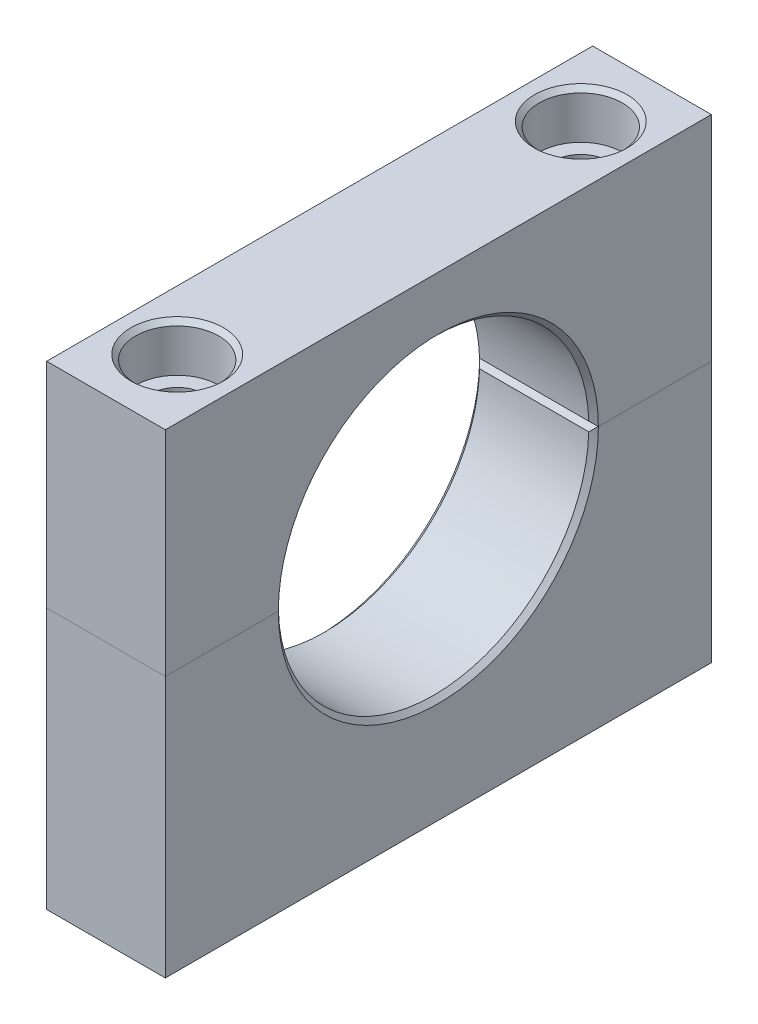
from build123d import *

# Parameters (mm, degrees)
BOSS_EXTRUDE1_DEPTH                           = 15.875
BOSS_EXTRUDE2_DEPTH                           = 15.875
CBORE_FOR_1_4_SOCKET_HEAD_CAP_SCREW1_AT_COUNT = 2
CBORE_FOR_1_4_SOCKET_HEAD_CAP_SCREW1_AT_PITCH = 53.975
MOVE_FACE1_BY                                 = 0.127
MOVE_FACE1_2_BY                               = 0.127
MOVE_START                                    = 28.575
MOVE_FACE2_OUTLINE_W                          = 15.875
MOVE_FACE2_OUTLINE_H                          = 73.025
MOVE_FACE2_OUTLINE_R                          = 5.55625
MOVE_FACE2_DEPTH                              = 6.35
MOVE_START_2                                  = 22.225
MOVE_FACE2_2_OUTLINE_R                        = 5.55625
MOVE_FACE2_2_OUTLINE_R_2                      = 3.57124
MOVE_FACE2_2_DEPTH                            = 6.35


with BuildPart() as part:
    # Sketch1 → Boss-Extrude1 (new body)
    with BuildSketch(Plane(origin=(0, 0, 0), x_dir=(0, 0, -1), z_dir=(1, 0, 0))):
        with BuildLine():
            Line((36.5125, 0), (20.6375, 0))
            ThreePointArc((20.6375, 0), (0, -20.6375), (-20.6375, 0))
            Line((-20.6375, 0), (-36.5125, 0))
            Line((-36.5125, 0), (-36.5125, -34.925))
            Line((-36.5125, -34.925), (36.5125, -34.925))
            Line((36.5125, -34.925), (36.5125, 0))
        make_face()
    extrude(amount=BOSS_EXTRUDE1_DEPTH)


with BuildPart() as body_2:
    # Sketch1<3> → Boss-Extrude2 (new body)
    with BuildSketch(Plane(origin=(0, 0, 0), x_dir=(0, 0, -1), z_dir=(1, 0, 0))):
        with BuildLine():
            ThreePointArc((-20.6375, 0), (0, 20.6375), (20.6375, 0))
            Line((20.6375, 0), (36.5125, 0))
            Line((36.5125, 0), (36.5125, 34.925))
            Line((36.5125, 34.925), (-36.5125, 34.925))
            Line((-36.5125, 34.925), (-36.5125, 0))
            Line((-36.5125, 0), (-20.6375, 0))
        make_face()
    extrude(amount=BOSS_EXTRUDE2_DEPTH)


with BuildPart() as cbore_for_1_4_socket_head_cap_screw1_tool:
    # Sketch4 → CBORE for 1/4 Socket Head Cap Screw1 (revolve)
    with BuildSketch(Plane(origin=(7.9375, 34.925, 26.9875), x_dir=(0, 0, 1), z_dir=(1, 0, 0))):
        Polygon((0, 0), (0, 69.85), (3.57124, 69.85), (3.57124, 6.35), (5.55625, 6.35), (5.55625, 0.635), (6.19125, 0), align=None)
    cbore_for_1_4_socket_head_cap_screw1 = revolve(axis=Axis((7.9375, 41.275, 26.9875), (0, -1, 0)))


with BuildPart() as part_1:
    add(part.part)

    # CBORE for 1/4 Socket Head Cap Screw1: cut by cbore_for_1_4_socket_head_cap_screw1_tool
    add(cbore_for_1_4_socket_head_cap_screw1_tool.part, mode=Mode.SUBTRACT)


with BuildPart() as body_2_1:
    add(body_2.part)

    # CBORE for 1/4 Socket Head Cap Screw1: cut by cbore_for_1_4_socket_head_cap_screw1_tool
    add(cbore_for_1_4_socket_head_cap_screw1_tool.part, mode=Mode.SUBTRACT)


with BuildPart() as cbore_for_1_4_socket_head_cap_screw1_at_tool:
    # CBORE for 1/4 Socket Head Cap Screw1 at: CBORE for 1/4 Socket Head Cap Screw1 ×2
    with Locations(*[(0, 0, -i * CBORE_FOR_1_4_SOCKET_HEAD_CAP_SCREW1_AT_PITCH) for i in range(1, CBORE_FOR_1_4_SOCKET_HEAD_CAP_SCREW1_AT_COUNT)]):
        add(cbore_for_1_4_socket_head_cap_screw1)


with BuildPart() as part_2:
    add(part_1.part)

    # CBORE for 1/4 Socket Head Cap Screw1 at: cut by cbore_for_1_4_socket_head_cap_screw1_at_tool
    add(cbore_for_1_4_socket_head_cap_screw1_at_tool.part, mode=Mode.SUBTRACT)

    # Move Face1 2: a curved face moved inward by 0.127
    add(Solid.thicken(part_2.faces().sort_by_distance((7.9375, -20.6375, 0))[0], -MOVE_FACE1_2_BY), mode=Mode.SUBTRACT)

    # Chamfer2
    # the kernel refuses this chamfer: 0.635 mm, written as the material it takes off along each edge
    with BuildSketch(Plane(origin=(0, 0, 0), x_dir=(0, 0.07868977926472538, -0.9968991516895122), z_dir=(0, 0.9968991516895122, 0.07868977926472538))) as chamfer2_piece_1:
        with BuildLine():
            Line((21.417460512, 0.017960512), (20.746539488, -0.652960512))
            Line((20.746539488, -0.652960512), (20.733839488, -0.652960512))
            ThreePointArc((20.733839488, -0.652960512), (20.7518, -0.326480256), (20.7518, 0))
            Line((20.7518, 0), (20.7645, 0.0127))
            ThreePointArc((20.7645, 0.0127), (21.090980256, 0.0127), (21.417460512, 0.030660512))
            Line((21.417460512, 0.030660512), (21.417460512, 0.017960512))
        make_face()
    revolve(axis=Axis((0, 0, 0), (-1, 0, 0)), revolution_arc=189.026516368, mode=Mode.SUBTRACT)
    with BuildSketch(Plane(origin=(-1.610111621, 0, -20.7645), x_dir=(0, 0, -1), z_dir=(1, 0, 0))) as chamfer2_piece_2:
        with BuildLine():
            Line((0.643801601, 0.017692029), (-0.027368853, -0.633849299))
            Line((-0.027368853, -0.633849299), (-0.040063261, -0.633472445))
            ThreePointArc((-0.040063261, -0.633472445), (-0.015119867, -0.316902726), (-0.0127, 0))
            Line((-0.0127, 0), (0, 0.0127))
            ThreePointArc((0, 0.0127), (0.3219008, 0.0127), (0.643801601, 0.030392029))
            Line((0.643801601, 0.030392029), (0.643801601, 0.017692029))
        make_face()
    extrude(amount=19.095223242, mode=Mode.SUBTRACT)
    with BuildSketch(Plane(origin=(-1.610111621, 0, 20.7645), x_dir=(0, -0.9998899044534173, -0.01483842889716635), z_dir=(1, 0, 0))) as chamfer2_piece_3:
        with BuildLine():
            Line((0.634185626, 0.017960512), (-0.027243086, -0.643468199))
            Line((-0.027243086, -0.643468199), (-0.039941687, -0.643279751))
            ThreePointArc((-0.039941687, -0.643279751), (-0.017475104, -0.321676913), (-0.012698602, 0.000188448))
            Line((-0.012698602, 0.000188448), (0.000188448, 0.012698602))
            ThreePointArc((0.000188448, 0.012698602), (0.317092192, 0.010415864), (0.633997178, 0.030659114))
            Line((0.633997178, 0.030659114), (0.634185626, 0.017960512))
        make_face()
    extrude(amount=19.095223242, mode=Mode.SUBTRACT)
    with BuildSketch(Plane(origin=(15.875, 0, 0), x_dir=(0, 0.0786897792647254, -0.9968991516895122), z_dir=(0, 0.9968991516895122, 0.0786897792647254))) as chamfer2_piece_4:
        with BuildLine():
            Line((20.746539488, 0.652960512), (21.417460512, -0.017960512))
            Line((21.417460512, -0.017960512), (21.417460512, -0.030660512))
            ThreePointArc((21.417460512, -0.030660512), (21.090980256, -0.0127), (20.7645, -0.0127))
            Line((20.7645, -0.0127), (20.7518, 0))
            ThreePointArc((20.7518, 0), (20.7518, 0.326480256), (20.733839488, 0.652960512))
            Line((20.733839488, 0.652960512), (20.746539488, 0.652960512))
        make_face()
    revolve(axis=Axis((15.875, 0, 0), (-1, 0, 0)), revolution_arc=189.026516368, mode=Mode.SUBTRACT)


with BuildPart() as body_2_2:
    add(body_2_1.part)

    # CBORE for 1/4 Socket Head Cap Screw1 at: cut by cbore_for_1_4_socket_head_cap_screw1_at_tool
    add(cbore_for_1_4_socket_head_cap_screw1_at_tool.part, mode=Mode.SUBTRACT)

    # Move Face1: a curved face moved inward by 0.127
    add(Solid.thicken(body_2_2.faces().sort_by_distance((7.9375, 20.6375, 0))[0], -MOVE_FACE1_BY), mode=Mode.SUBTRACT)

    # Move Face2: read off the stored shape, not the designer's step
    # Move Face2 outline → Move Face2 (cut)
    with BuildSketch(Plane(origin=(0, 0, 0), x_dir=(1, 0, 0), z_dir=(0, 1, 0)).offset(MOVE_START)):
        with Locations((7.9375, 0)):
            Rectangle(MOVE_FACE2_OUTLINE_W, MOVE_FACE2_OUTLINE_H)
        with Locations((7.9375, -26.9875)):
            Circle(MOVE_FACE2_OUTLINE_R, mode=Mode.SUBTRACT)
        with Locations((7.9375, 26.9875)):
            Circle(MOVE_FACE2_OUTLINE_R, mode=Mode.SUBTRACT)
    extrude(amount=MOVE_FACE2_DEPTH, mode=Mode.SUBTRACT)

    # Move Face2 2 outline → Move Face2 2 (cut)
    # profile 1 of 2: a face of its own
    with BuildSketch(Plane(origin=(0, 0, 0), x_dir=(1, 0, 0), z_dir=(0, 1, 0)).offset(MOVE_START_2)):
        with Locations((7.9375, 26.9875)):
            Circle(MOVE_FACE2_2_OUTLINE_R)
        with Locations((7.9375, 26.9875)):
            Circle(MOVE_FACE2_2_OUTLINE_R_2, mode=Mode.SUBTRACT)
    # profile 2 of 2: a face of its own
    with BuildSketch(Plane(origin=(0, 0, 0), x_dir=(1, 0, 0), z_dir=(0, 1, 0)).offset(MOVE_START_2)):
        with Locations((7.9375, -26.9875)):
            Circle(MOVE_FACE2_2_OUTLINE_R)
        with Locations((7.9375, -26.9875)):
            Circle(MOVE_FACE2_2_OUTLINE_R_2, mode=Mode.SUBTRACT)
    extrude(amount=MOVE_FACE2_2_DEPTH, mode=Mode.SUBTRACT)

    # Move Face2 3: loft between two sections, ruled curve by curve
    move_face2_3_from = [
        Edge.make_three_point_arc((7.9375, 27.94, -21.43125), (13.49375, 27.94, -26.9875), (7.9375, 27.94, -32.54375)),
        Edge.make_three_point_arc((7.9375, 27.94, -32.54375), (2.38125, 27.94, -26.9875), (7.9375, 27.94, -21.43125)),
    ]
    move_face2_3_to = [
        Edge.make_three_point_arc((7.9375, 28.575, -20.79625), (14.12875, 28.575, -26.9875), (7.9375, 28.575, -33.17875)),
        Edge.make_three_point_arc((7.9375, 28.575, -33.17875), (1.74625, 28.575, -26.9875), (7.9375, 28.575, -20.79625)),
    ]
    move_face2_3 = Solid(Shell([*[Face.make_surface_from_curves(move_face2_3_from[k], move_face2_3_to[k]) for k in range(2)], Face(Wire(move_face2_3_from)), Face(Wire(move_face2_3_to))]))
    add(move_face2_3, mode=Mode.SUBTRACT)

    # Move Face2 4: loft between two sections, ruled curve by curve
    move_face2_4_from = [
        Edge.make_three_point_arc((7.9375, 27.94, 32.54375), (13.49375, 27.94, 26.9875), (7.9375, 27.94, 21.43125)),
        Edge.make_three_point_arc((7.9375, 27.94, 21.43125), (2.38125, 27.94, 26.9875), (7.9375, 27.94, 32.54375)),
    ]
    move_face2_4_to = [
        Edge.make_three_point_arc((7.9375, 28.575, 33.17875), (14.12875, 28.575, 26.9875), (7.9375, 28.575, 20.79625)),
        Edge.make_three_point_arc((7.9375, 28.575, 20.79625), (1.74625, 28.575, 26.9875), (7.9375, 28.575, 33.17875)),
    ]
    move_face2_4 = Solid(Shell([*[Face.make_surface_from_curves(move_face2_4_from[k], move_face2_4_to[k]) for k in range(2)], Face(Wire(move_face2_4_from)), Face(Wire(move_face2_4_to))]))
    add(move_face2_4, mode=Mode.SUBTRACT)

    # Chamfer1
    # the kernel refuses this chamfer: 0.635 mm, written as the material it takes off along each edge
    with BuildSketch(Plane(origin=(0, 0, 0), x_dir=(0, -0.0786897792647251, 0.9968991516895122), z_dir=(0, -0.9968991516895122, -0.0786897792647251))) as chamfer1_piece_1:
        with BuildLine():
            Line((21.417460512, 0.017960512), (20.746539488, -0.652960512))
            Line((20.746539488, -0.652960512), (20.733839488, -0.652960512))
            ThreePointArc((20.733839488, -0.652960512), (20.7518, -0.326480256), (20.7518, 0))
            Line((20.7518, 0), (20.7645, 0.0127))
            ThreePointArc((20.7645, 0.0127), (21.090980256, 0.0127), (21.417460512, 0.030660512))
            Line((21.417460512, 0.030660512), (21.417460512, 0.017960512))
        make_face()
    revolve(axis=Axis((0, 0, 0), (-1, 0, 0)), revolution_arc=189.026516368, mode=Mode.SUBTRACT)
    with BuildSketch(Plane(origin=(-1.610111621, 0, 20.7645), x_dir=(0, 0, 1), z_dir=(1, 0, 0))) as chamfer1_piece_2:
        with BuildLine():
            Line((0.643801601, 0.017692029), (-0.027368853, -0.633849299))
            Line((-0.027368853, -0.633849299), (-0.040063261, -0.633472445))
            ThreePointArc((-0.040063261, -0.633472445), (-0.015119867, -0.316902726), (-0.0127, 0))
            Line((-0.0127, 0), (0, 0.0127))
            ThreePointArc((0, 0.0127), (0.3219008, 0.0127), (0.643801601, 0.030392029))
            Line((0.643801601, 0.030392029), (0.643801601, 0.017692029))
        make_face()
    extrude(amount=19.095223242, mode=Mode.SUBTRACT)
    with BuildSketch(Plane(origin=(-1.610111621, 0, -20.7645), x_dir=(0, 0.9998899044534173, 0.014838428897166573), z_dir=(1, 0, 0))) as chamfer1_piece_3:
        with BuildLine():
            Line((0.634185626, 0.017960512), (-0.027243086, -0.643468199))
            Line((-0.027243086, -0.643468199), (-0.039941687, -0.643279751))
            ThreePointArc((-0.039941687, -0.643279751), (-0.017475104, -0.321676913), (-0.012698602, 0.000188448))
            Line((-0.012698602, 0.000188448), (0.000188448, 0.012698602))
            ThreePointArc((0.000188448, 0.012698602), (0.317092192, 0.010415864), (0.633997178, 0.030659114))
            Line((0.633997178, 0.030659114), (0.634185626, 0.017960512))
        make_face()
    extrude(amount=19.095223242, mode=Mode.SUBTRACT)
    with BuildSketch(Plane(origin=(15.875, 0, 0), x_dir=(0, -0.07868977926472513, 0.9968991516895122), z_dir=(0, -0.9968991516895122, -0.07868977926472513))) as chamfer1_piece_4:
        with BuildLine():
            Line((20.746539488, 0.652960512), (21.417460512, -0.017960512))
            Line((21.417460512, -0.017960512), (21.417460512, -0.030660512))
            ThreePointArc((21.417460512, -0.030660512), (21.090980256, -0.0127), (20.7645, -0.0127))
            Line((20.7645, -0.0127), (20.7518, 0))
            ThreePointArc((20.7518, 0), (20.7518, 0.326480256), (20.733839488, 0.652960512))
            Line((20.733839488, 0.652960512), (20.746539488, 0.652960512))
        make_face()
    revolve(axis=Axis((15.875, 0, 0), (-1, 0, 0)), revolution_arc=189.026516368, mode=Mode.SUBTRACT)


solid = Compound([part_2.part, body_2_2.part])
